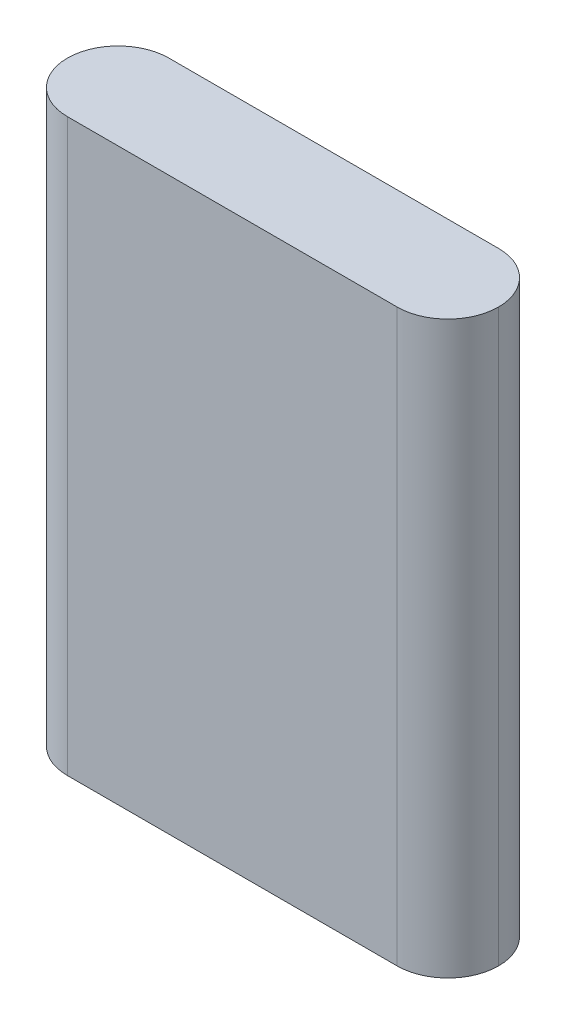
from build123d import *

# Parameters (mm, degrees)
SKETCH1_W           = 34
SKETCH1_H           = 45
BOSS_EXTRUDE1_DEPTH = 8
FILLET1_R           = 4


with BuildPart() as part:
    # Sketch1 → Boss-Extrude1 (new body)
    with BuildSketch(Plane.XY):
        with Locations((17, 22.5)):
            Rectangle(SKETCH1_W, SKETCH1_H)
    extrude(amount=BOSS_EXTRUDE1_DEPTH)

    # Fillet1
    fillet1_edges = [part.edges().sort_by_distance(p)[0] for p in [
        (34, 22.5, 8),
        (34, 22.5, 0),
        (0, 22.5, 0),
        (0, 22.5, 8),
    ]]
    fillet(fillet1_edges, radius=FILLET1_R - 0.0001)  # a hair under: the kernel refuses the full size


solid = part.part
